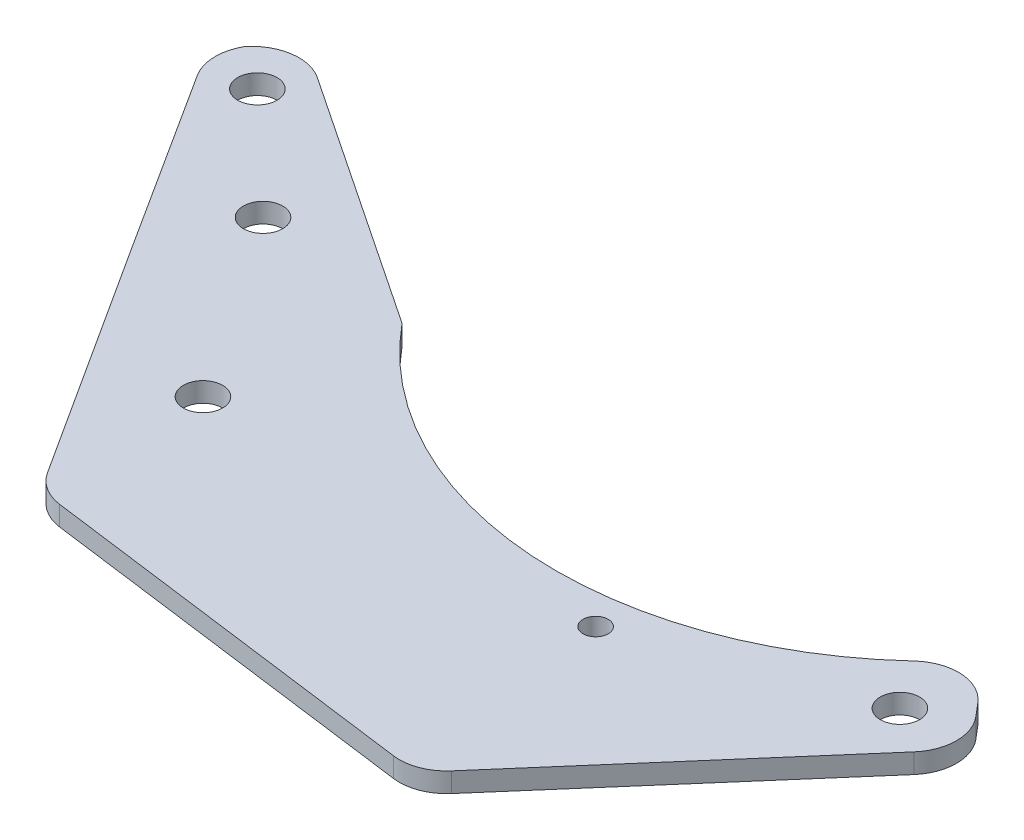
from build123d import *

# Parameters (mm, degrees)
SKETCH1_R           = 3.175
SKETCH1_R_2         = 2.032
BOSS_EXTRUDE1_DEPTH = 3.175
FILLET1_R           = 7.62


with BuildPart() as part:
    # Sketch1 → Boss-Extrude1 (new body)
    # profile 1 of 2: a face of its own
    with BuildSketch(Plane(origin=(0, 0, 0), x_dir=(1, 0, 0), z_dir=(0, 1, 0))):
        with BuildLine():
            Line((105.591118199, -28.343622072), (94.077776645, -14.794770967))
            ThreePointArc((94.077776645, -14.794770967), (47.065246085, -36.873172811), (0.097776645, -14.699073687))
            Line((0.097776645, -14.699073687), (-31.782789553, -26.688950722))
            Line((-31.782789553, -26.688950722), (-5.708312831, -67.169135043))
            Line((-5.708312831, -67.169135043), (63.939848964, -76.376354726))
            Line((63.939848964, -76.376354726), (105.591118199, -28.343622072))
        make_face()
        with Locations(Location((-5.708312831, -41.020609427, 0), (0, 0, 270))):
            Circle(SKETCH1_R, mode=Mode.SUBTRACT)
        with Locations(Location((58.097885383, -41.467741904, 0), (0, 0, 270))):
            Circle(SKETCH1_R_2, mode=Mode.SUBTRACT)
        with Locations(Location((94.077776645, -28.343622072, 0), (0, 0, 270))):
            Circle(SKETCH1_R, mode=Mode.SUBTRACT)
    # profile 2 of 2: a face of its own
    with BuildSketch(Plane(origin=(0, 0, 0), x_dir=(1, 0, 0), z_dir=(0, 1, 0))):
        Polygon((-31.782789553, -26.688950722), (0.097776645, -14.699073687), (-47.44057022, 17.052204331), (-53.745234427, 7.612794876), align=None)
        with Locations(Location((-25.919844617, -11.116586696, 0), (0, 0, 270))):
            Circle(SKETCH1_R, mode=Mode.SUBTRACT)
        with Locations(Location((-44.331222359, 6.381446612, 0), (0, 0, 270))):
            Circle(SKETCH1_R, mode=Mode.SUBTRACT)
    extrude(amount=BOSS_EXTRUDE1_DEPTH)

    # Fillet1
    # the kernel refuses this fillet: 7.62 mm, written as the material it takes off along each edge
    with BuildSketch(Plane(origin=(94.077776645, -21.209715088, 14.794770967), x_dir=(0.6475445193715758, 0, 0.7620276211738226), z_dir=(0, 1, 0))) as fillet1_piece_1:
        with BuildLine():
            CenterArc((8.483886035, -7.62), FILLET1_R, 90, 92.490451597)
            ThreePointArc((0.871083301, -7.951111055), (0.566092443, -3.961253046), (0, 0))
            Line((0, 0), (8.483886035, 0))
        make_face()
    extrude(amount=45.594430177, mode=Mode.SUBTRACT)
    with BuildSketch(Plane(origin=(105.591118199, -16.352843569, 28.343622072), x_dir=(-0.6551362182138352, 0, 0.755510777940642), z_dir=(0, 1, 0))) as fillet1_piece_2:
        with BuildLine():
            CenterArc((FILLET1_R * 0.858416985261, -FILLET1_R), FILLET1_R, 90, 81.28670352)
            Line((-FILLET1_R * 0.130041772231, -FILLET1_R * 0.848509786661), (0, 0))
            Line((0, 0), (FILLET1_R * 0.858416985261, 0))
        make_face()
    extrude(amount=35.880687138, mode=Mode.SUBTRACT)
    with BuildSketch(Plane(origin=(63.939848964, -10.25750483, 76.376354726), x_dir=(0.6551362182138344, 0, -0.7555107779406426), z_dir=(0, 1, 0))) as fillet1_piece_3:
        with BuildLine():
            CenterArc((FILLET1_R * 0.538451697109, FILLET1_R), FILLET1_R, 213.399362726, 56.600637274)
            Line((-FILLET1_R * 0.296402288845, FILLET1_R * 0.449528545576), (0, 0))
            Line((0, 0), (FILLET1_R * 0.538451697109, 0))
        make_face()
    extrude(amount=23.69000966, mode=Mode.SUBTRACT)
    with BuildSketch(Plane(origin=(-5.708312831, -8.81900629, 67.169135043), x_dir=(0.9913749712814725, 0, 0.13105596635277514), z_dir=(0, 1, 0))) as fillet1_piece_4:
        with BuildLine():
            CenterArc((FILLET1_R * 0.462939962752, FILLET1_R), FILLET1_R, 220.317392239, 49.682607761)
            Line((-FILLET1_R * 0.29953199758, FILLET1_R * 0.352978740916), (0, 0))
            Line((0, 0), (FILLET1_R * 0.462939962752, 0))
        make_face()
    extrude(amount=20.813012581, mode=Mode.SUBTRACT)
    with BuildSketch(Plane(origin=(-47.44057022, -19.05, -17.052204331), x_dir=(0.8315732701891384, 0, 0.5554150666906167), z_dir=(0, 1, 0))) as fillet1_piece_5:
        with BuildLine():
            CenterArc((FILLET1_R, -FILLET1_R), FILLET1_R, 90, 90)
            Line((0, -FILLET1_R), (0, 0))
            Line((0, 0), (FILLET1_R, 0))
        make_face()
    extrude(amount=41.275, mode=Mode.SUBTRACT)
    with BuildSketch(Plane(origin=(-53.745234427, -12.458754806, -7.612794876), x_dir=(0.5392161516528728, 0, 0.8421674072277234), z_dir=(0, 1, 0))) as fillet1_piece_6:
        with BuildLine():
            CenterArc((FILLET1_R * 0.654002876977, FILLET1_R), FILLET1_R, 203.630396876, 66.369603124)
            Line((-FILLET1_R * 0.262147328242, FILLET1_R * 0.599164869956), (0, 0))
            Line((0, 0), (FILLET1_R * 0.654002876977, 0))
        make_face()
    extrude(amount=28.092509613, mode=Mode.SUBTRACT)


solid = part.part
